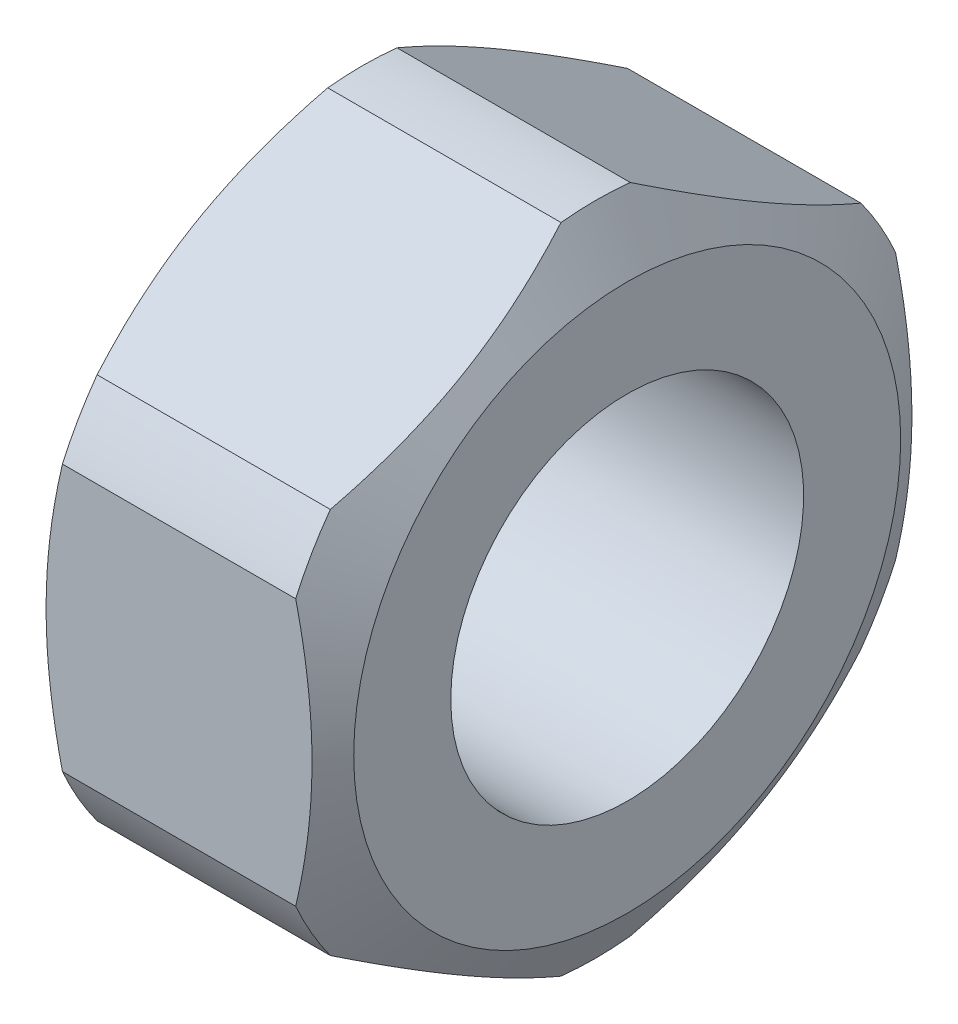
from build123d import *

# Parameters (mm, degrees)
SKETCH_2_OUTSIDE_W  = 26.122
SKETCH_2_OUTSIDE_H  = 26.122
CUT_EXTRUDE_1_DEPTH = 16.605768164


with BuildPart() as part:
    # Эскиз1 → Повернуть1 (revolve)
    with BuildSketch(Plane.XY):
        Polygon((4.2, 5), (-4.2, 5), (-4.2, 7.75), (-3.305107083, 9.3), (3.305107083, 9.3), (4.2, 7.75), align=None)
    revolve(axis=Axis((-345.378129483, 0, 0), (1, 0, 0)))

    # Эскиз2 outside → Вырез-Вытянуть1 (cut, through all)
    with BuildSketch(Plane.ZY.offset(4.2)):
        Rectangle(SKETCH_2_OUTSIDE_W, SKETCH_2_OUTSIDE_H)
        Polygon((0, -9.814954576), (8.5, -4.907477288), (8.5, 4.907477288), (0, 9.814954576), (-8.5, 4.907477288), (-8.5, -4.907477288), align=None, mode=Mode.SUBTRACT)
    extrude(amount=-CUT_EXTRUDE_1_DEPTH, mode=Mode.SUBTRACT)


solid = part.part
